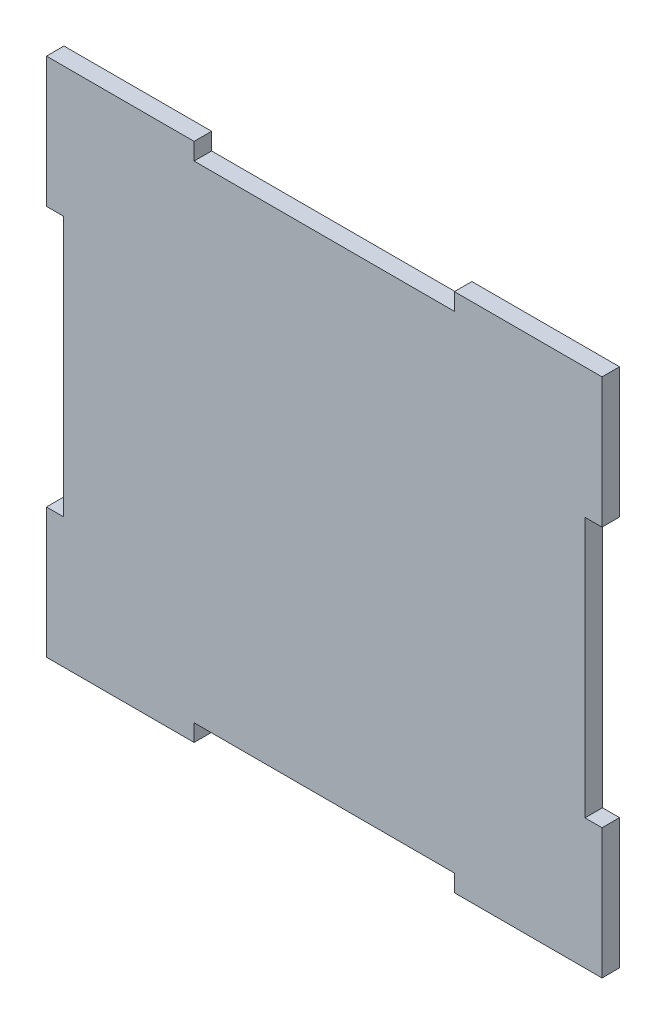
from build123d import *

# Parameters (mm, degrees)
SKETCH1_W           = 106.72
SKETCH1_H           = 100
BOSS_EXTRUDE1_DEPTH = 3.36
SKETCH10_W          = 50
SKETCH10_H          = 3.28
CUT_EXTRUDE1_DEPTH  = 3.36
SKETCH11_W          = 3.28
SKETCH11_H          = 50
CUT_EXTRUDE2_DEPTH  = 74.202316903


with BuildPart() as part:
    # Sketch1 → Boss-Extrude1 (new body)
    with BuildSketch(Plane.XY):
        Rectangle(SKETCH1_W, SKETCH1_H)
    extrude(amount=BOSS_EXTRUDE1_DEPTH)

    # Sketch10 → Cut-Extrude1 (cut)
    with BuildSketch(Plane.XY.offset(3.36)):
        with Locations((0, 48.36)):
            Rectangle(SKETCH10_W, SKETCH10_H)
    cut_extrude1 = extrude(amount=-CUT_EXTRUDE1_DEPTH, mode=Mode.SUBTRACT)

    # Mirror6: Cut-Extrude1 across plane
    add(cut_extrude1.mirror(Plane.ZX), mode=Mode.SUBTRACT)

    # Sketch11 → Cut-Extrude2 (cut, through all)
    with BuildSketch(Plane.XY.offset(3.36)):
        with Locations((51.72, 0)):
            Rectangle(SKETCH11_W, SKETCH11_H)
    cut_extrude2 = extrude(amount=-CUT_EXTRUDE2_DEPTH, mode=Mode.SUBTRACT)

    # Mirror7: Cut-Extrude2 across plane
    add(cut_extrude2.mirror(Plane(origin=(0, 0, 0), x_dir=(0, 0, 1), z_dir=(1, 0, 0))), mode=Mode.SUBTRACT)


solid = part.part
